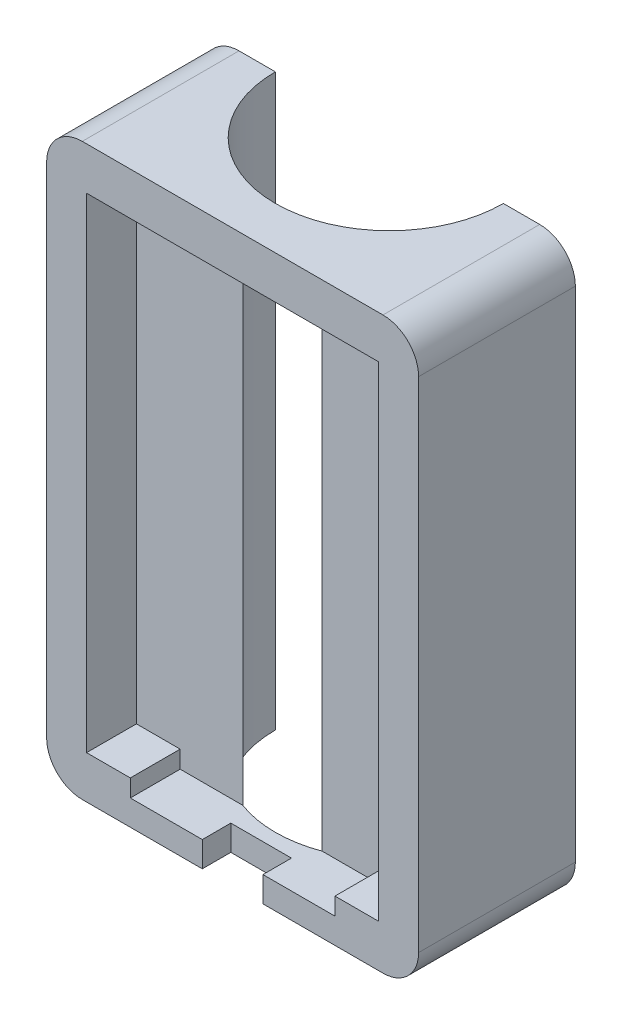
from build123d import *

# Parameters (mm, degrees)
ESQUISSE1_W             = 52.2
ESQUISSE1_H             = 80
BOSS_EXTRU_2_DEPTH      = 22
ESQUISSE3_W             = 48.72
ESQUISSE3_H             = 72.8776
ENL_V_MAT_EXTRU_1_DEPTH = 5
CONG_1_R                = 10
CONG_2_R                = 5
BOSS_EXTRU_4_DEPTH      = 5
ESQUISSE2_R             = 16
ENL_V_MAT_EXTRU_3_DEPTH = 93.647092521
ENL_V_MAT_EXTRU_5_DEPTH = 2
ESQUISSE8_W             = 8.51
ESQUISSE8_H             = 3.5612
ENL_V_MAT_EXTRU_6_DEPTH = 4


with BuildPart() as part:
    # Esquisse1 → Boss.-Extru.2 (new body)
    with BuildSketch(Plane.XY):
        with Locations((-15.124795362, -42.006460905)):
            Rectangle(ESQUISSE1_W, ESQUISSE1_H)
    extrude(amount=BOSS_EXTRU_2_DEPTH)

    # Esquisse3 → Enlèv. mat.-Extru.1 (cut)
    with BuildSketch(Plane.XY.offset(22)):
        with Locations((-15.124795362, -42.006460905)):
            Rectangle(ESQUISSE3_W, ESQUISSE3_H)
    extrude(amount=-ENL_V_MAT_EXTRU_1_DEPTH, mode=Mode.SUBTRACT)

    # Congé1
    cong_1_edges = [part.edges().sort_by_distance(p)[0] for p in [
        (-39.484795362, -78.445260905, 19.5),
        (9.235204638, -78.445260905, 19.5),
        (9.235204638, -5.567660905, 19.5),
        (-39.484795362, -5.567660905, 19.5),
    ]]
    fillet(cong_1_edges, radius=CONG_1_R)

    # Congé2
    cong_2_edges = [part.edges().sort_by_distance(p)[0] for p in [
        (-41.224795362, -82.006460905, 11),
        (10.975204638, -82.006460905, 11),
        (10.975204638, -2.006460905, 11),
        (-41.224795362, -2.006460905, 11),
    ]]
    fillet(cong_2_edges, radius=CONG_2_R)

    # Esquisse5 → Boss.-Extru.4 (add)
    with BuildSketch(Plane.XY.offset(17)):
        with BuildLine():
            Line((-35.624795362, -15.567660905), (-35.624795362, -8.006460905))
            Line((-35.624795362, -8.006460905), (-29.484795362, -8.006460905))
            Line((-29.484795362, -8.006460905), (-0.764795362, -8.006460905))
            Line((-0.764795362, -8.006460905), (5.375204638, -8.006460905))
            Line((5.375204638, -8.006460905), (5.375204638, -15.567660905))
            Line((5.375204638, -15.567660905), (5.375204638, -68.445260905))
            Line((5.375204638, -68.445260905), (5.375204638, -76.006460905))
            Line((5.375204638, -76.006460905), (-0.764795362, -76.006460905))
            Line((-0.764795362, -76.006460905), (-0.764795362, -78.445260905))
            ThreePointArc((-0.764795362, -78.445260905), (6.30627245, -75.516328717), (9.235204638, -68.445260905))
            Line((9.235204638, -68.445260905), (9.235204638, -15.567660905))
            ThreePointArc((9.235204638, -15.567660905), (6.30627245, -8.496593093), (-0.764795362, -5.567660905))
            Line((-0.764795362, -5.567660905), (-29.484795362, -5.567660905))
            ThreePointArc((-29.484795362, -5.567660905), (-36.555863174, -8.496593093), (-39.484795362, -15.567660905))
            Line((-39.484795362, -15.567660905), (-39.484795362, -68.445260905))
            ThreePointArc((-39.484795362, -68.445260905), (-36.555863174, -75.516328717), (-29.484795362, -78.445260905))
            Line((-29.484795362, -78.445260905), (-29.484795362, -76.006460905))
            Line((-29.484795362, -76.006460905), (-35.624795362, -76.006460905))
            Line((-35.624795362, -76.006460905), (-35.624795362, -68.445260905))
            Line((-35.624795362, -68.445260905), (-35.624795362, -15.567660905))
        make_face()
    extrude(amount=BOSS_EXTRU_4_DEPTH)

    # Esquisse2 → Enlèv. mat.-Extru.3 (cut, through all)
    with BuildSketch(Plane.XZ.offset(82.006460905)):
        with Locations((-15.124795362, 0)):
            Circle(ESQUISSE2_R)
    extrude(amount=-ENL_V_MAT_EXTRU_3_DEPTH, mode=Mode.SUBTRACT)

    # Esquisse7 → Enlèv. mat.-Extru.5 (cut)
    with BuildSketch(Plane.XY.offset(17)):
        Polygon((-35.624795362, -8.006460905), (5.375204638, -8.006460905), (5.375204638, -76.006460905), (-0.764795362, -76.006460905), (-0.764795362, -78.445260905), (-29.484795362, -78.445260905), (-29.484795362, -76.006460905), (-35.624795362, -76.006460905), align=None)
    extrude(amount=-ENL_V_MAT_EXTRU_5_DEPTH, mode=Mode.SUBTRACT)

    # Esquisse8 → Enlèv. mat.-Extru.6 (cut)
    with BuildSketch(Plane.XY.offset(22)):
        with Locations((-15.124795362, -80.225860905)):
            Rectangle(ESQUISSE8_W, ESQUISSE8_H)
    extrude(amount=-ENL_V_MAT_EXTRU_6_DEPTH, mode=Mode.SUBTRACT)


solid = part.part
